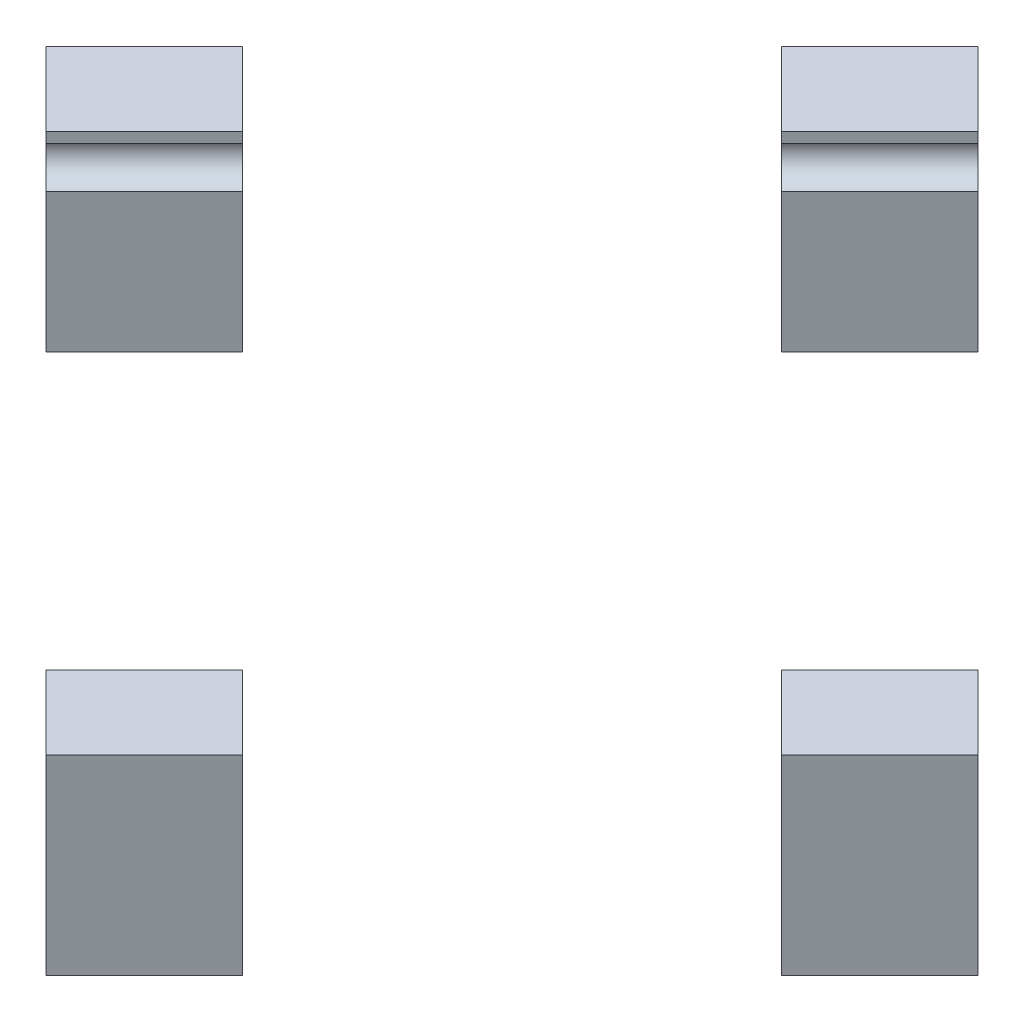
from build123d import *

# Parameters (mm, degrees)
BOSS_EXTRUDE3_DEPTH     = 5.5
BOSS_EXTRUDE3_2_DEPTH   = 5.5
BOSS_EXTRUDE3_3_DEPTH   = 5.5
BOSS_EXTRUDE3_4_DEPTH   = 5.5
CUT_EXTRUDE2_DEPTH      = 33.01946696
CUT_EXTRUDE2_DEPTH_BACK = 33.01946696
CUT_EXTRUDE5_DEPTH      = 33.01946696


with BuildPart() as part:
    # Sketch5 → Boss-Extrude3 (new body)
    with BuildSketch(Plane(origin=(0, 0, 0), x_dir=(1, 0, 0), z_dir=(0, 1, 0))):
        Polygon((8.86748372, -6.099716767), (11.695910845, -3.271289643), (9.574590502, -1.149969299), (6.746163377, -3.978396424), align=None)
    extrude(amount=BOSS_EXTRUDE3_DEPTH)


with BuildPart() as body_2:
    # Sketch5 → Boss-Extrude3 2 (new body)
    with BuildSketch(Plane(origin=(0, 0, 0), x_dir=(1, 0, 0), z_dir=(0, 1, 0))):
        Polygon((-6.688865466, 9.456632419), (-3.860438341, 12.285059543), (-5.981758685, 14.406379887), (-8.810185809, 11.577952762), align=None)
    extrude(amount=BOSS_EXTRUDE3_2_DEPTH)


with BuildPart() as body_3:
    # Sketch5 → Boss-Extrude3 3 (new body)
    with BuildSketch(Plane(origin=(0, 0, 0), x_dir=(1, 0, 0), z_dir=(0, 1, 0))):
        Polygon((-17.285059543, -1.139561659), (-14.456632419, 1.688865466), (-16.577952762, 3.810185809), (-19.406379887, 0.981758685), align=None)
    extrude(amount=BOSS_EXTRUDE3_3_DEPTH)


with BuildPart() as body_4:
    # Sketch5 → Boss-Extrude3 4 (new body)
    with BuildSketch(Plane(origin=(0, 0, 0), x_dir=(1, 0, 0), z_dir=(0, 1, 0))):
        Polygon((-1.728710357, -16.695910845), (1.099716767, -13.86748372), (-1.021603576, -11.746163377), (-3.850030701, -14.574590502), align=None)
    extrude(amount=BOSS_EXTRUDE3_4_DEPTH)


with BuildPart() as cut_extrude2_tool:
    # Sketch6 → Cut-Extrude2 (new, two sides: drawn at the far end of the back side and taken through both)
    with BuildSketch(Plane(origin=(4.212310601, 0, -4.212310601), x_dir=(-0.7071067811865475, 0, -0.7071067811865477), z_dir=(0.7071067811865477, 0, -0.7071067811865475)).offset(-CUT_EXTRUDE2_DEPTH_BACK)):
        with BuildLine():
            Line((66.254711859, 5.2), (-7.58340896, 5.2))
            ThreePointArc((-7.58340896, 5.2), (-8.18340896, 4.6), (-7.58340896, 4))
            Line((-7.58340896, 4), (66.254711859, 4))
            Line((66.254711859, 4), (213.930953499, 4))
            Line((213.930953499, 4), (213.930953499, 5.2))
            Line((213.930953499, 5.2), (66.254711859, 5.2))
        make_face()
    extrude(amount=CUT_EXTRUDE2_DEPTH + CUT_EXTRUDE2_DEPTH_BACK)


with BuildPart() as body_4_1:
    add(body_4.part)

    # Cut-Extrude2: cut by cut_extrude2_tool
    add(cut_extrude2_tool.part, mode=Mode.SUBTRACT)


with BuildPart() as part_1:
    add(part.part)

    # Cut-Extrude2: cut by cut_extrude2_tool
    add(cut_extrude2_tool.part, mode=Mode.SUBTRACT)


with BuildPart() as cut_extrude5_tool:
    # Sketch7 → Cut-Extrude5 (new, through all)
    with BuildSketch(Plane(origin=(4.212310601, 0, -4.212310601), x_dir=(-0.7071067811865479, 0, -0.7071067811865472), z_dir=(0.7071067811865472, 0, -0.7071067811865479))):
        with BuildLine():
            Line((11.41659104, 5.2), (11.41659104, 4))
            ThreePointArc((11.41659104, 4), (12.01659104, 4.6), (11.41659104, 5.2))
        make_face()
    extrude(amount=-CUT_EXTRUDE5_DEPTH)


with BuildPart() as body_2_1:
    add(body_2.part)

    # Cut-Extrude5: cut by cut_extrude5_tool
    add(cut_extrude5_tool.part, mode=Mode.SUBTRACT)


with BuildPart() as body_3_1:
    add(body_3.part)

    # Cut-Extrude5: cut by cut_extrude5_tool
    add(cut_extrude5_tool.part, mode=Mode.SUBTRACT)


solid = Compound([body_4_1.part, part_1.part, body_2_1.part, body_3_1.part])
